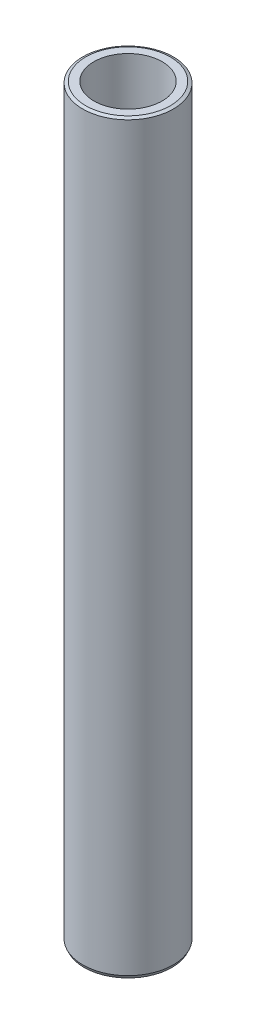
from build123d import *
from OCP.BRepFilletAPI import BRepFilletAPI_MakeChamfer

# Parameters (mm, degrees)
SKETCH1_R           = 15
BOSS_EXTRUDE1_DEPTH = 247.08629342
SKETCH2_R           = 11.305678923
CUT_EXTRUDE1_DEPTH  = 248.995234624
CHAMFER1_SIZE       = 0.455163926
CHAMFER1_SIZE2      = 0.986827135


with BuildPart() as part:
    # Sketch1 → Boss-Extrude1 (new body)
    with BuildSketch(Plane(origin=(0, 0, 0), x_dir=(1, 0, 0), z_dir=(0, 1, 0))):
        Circle(SKETCH1_R)
    extrude(amount=BOSS_EXTRUDE1_DEPTH)

    # Sketch2 → Cut-Extrude1 (cut, through all)
    with BuildSketch(Plane(origin=(0, 0, 0), x_dir=(1, 0, 0), z_dir=(0, 1, 0))):
        Circle(SKETCH2_R)
    extrude(amount=CUT_EXTRUDE1_DEPTH, mode=Mode.SUBTRACT)

    # Chamfer1: one chamfer whose edges measure the first distance from different faces: ONE call of the kernel's chamfer builder (chamfer() names one face for all edges)
    chamfer1_edges_1 = [part.edges().sort_by_distance(p)[0] for p in [
        (-15, 247.08629342, 0),
    ]]
    chamfer1_side_1 = [part.faces().sort_by_distance(p)[0] for p in [
        (-15, 123.54314671, 0),
    ]]
    chamfer1_edges_2 = [part.edges().sort_by_distance(p)[0] for p in [
        (-15, 0, 0),
    ]]
    chamfer1_side_2 = [part.faces().sort_by_distance(p)[0] for p in [
        (-14.575735931, 0, 0),
    ]]
    chamfer1 = BRepFilletAPI_MakeChamfer(part.part.solid().wrapped)
    for e in chamfer1_edges_1:
        chamfer1.Add(CHAMFER1_SIZE, CHAMFER1_SIZE2, e.wrapped, chamfer1_side_1[0].wrapped)  # the first distance lies on this face
    for e in chamfer1_edges_2:
        chamfer1.Add(CHAMFER1_SIZE, CHAMFER1_SIZE2, e.wrapped, chamfer1_side_2[0].wrapped)  # the first distance lies on this face
    add(Compound.cast(chamfer1.Shape()), mode=Mode.REPLACE)


solid = part.part
